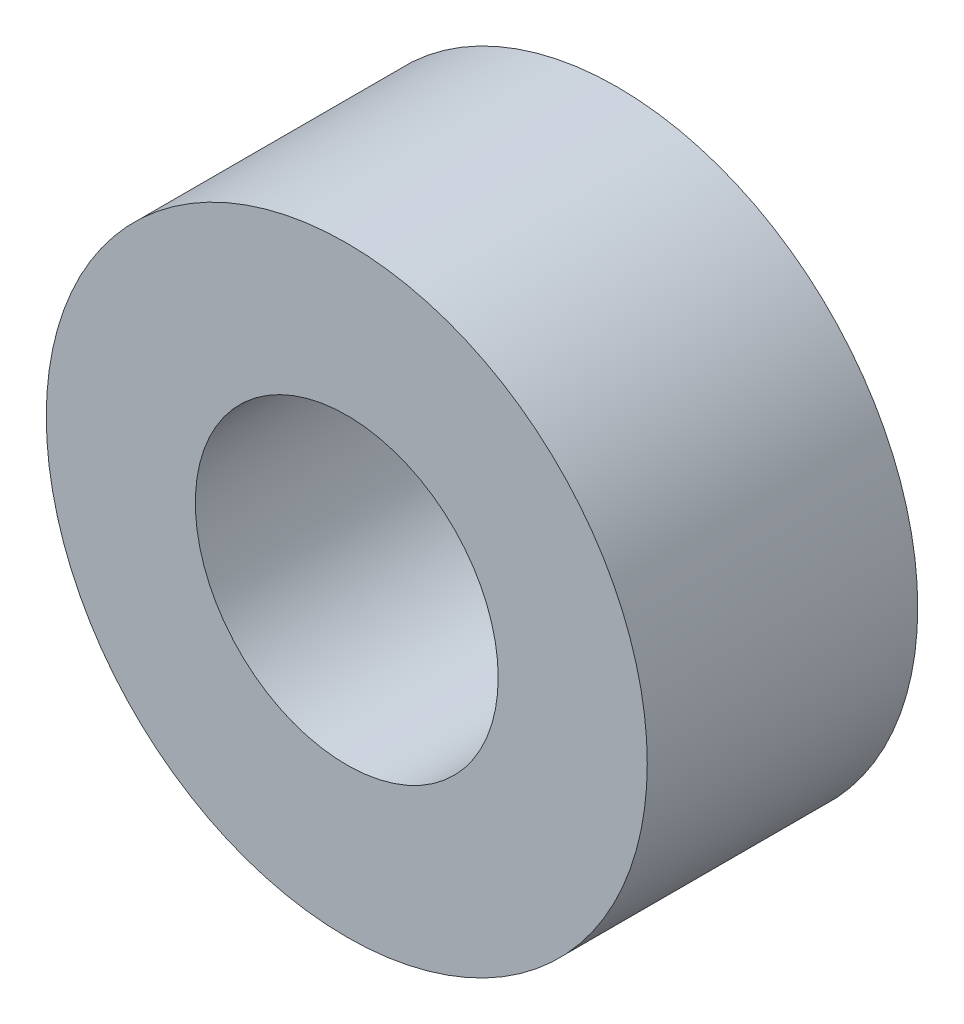
from build123d import *

# Parameters (mm, degrees)
SKETCH1_R           = 7.9375
SKETCH1_R_2         = 4
BOSS_EXTRUDE1_DEPTH = 7.14375


with BuildPart() as part:
    # Sketch1 → Boss-Extrude1 (new body)
    with BuildSketch(Plane.XY):
        Circle(SKETCH1_R)
        Circle(SKETCH1_R_2, mode=Mode.SUBTRACT)
    extrude(amount=BOSS_EXTRUDE1_DEPTH)


solid = part.part
